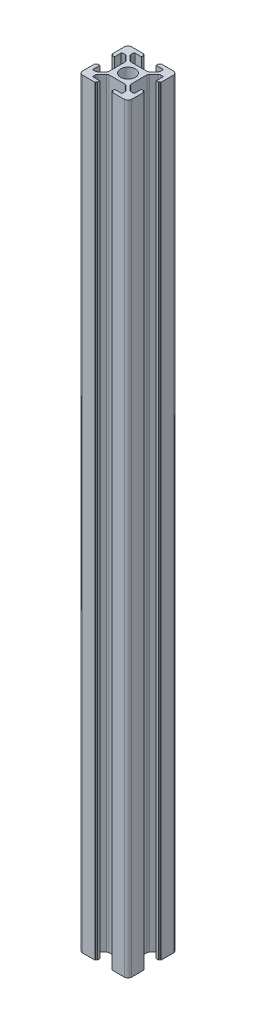
from build123d import *

# Parameters (mm, degrees)
BOSS_EXTRU_1_CORPS_DEPTH    = 310
CONG_1_R                    = 1.5
CONG_2_R                    = 0.4
CONG_4_R                    = 1
CONG_1_OF_SYM_TRIE_BRAS_R   = 1.5
CONG_2_OF_SYM_TRIE_BRAS_R   = 0.4
CONG_4_OF_SYM_TRIE_BRAS_R   = 1
SYM_TRIE_BRAS_DOUBLE_DEPTH  = 310
APR_S_TARODAGE_M6_R         = 3
ENL_V_MAT_FILETAGE_M6_DEPTH = 311.322412984


# Read off the part's stored shape, not the designer's step: Symétrie Bras double
with BuildPart() as part:
    # Esquisse4 → Boss.-Extru.1 Corps (new body)
    with BuildSketch(Plane(origin=(0, 0, 0), x_dir=(1, 0, 0), z_dir=(0, 1, 0))):
        Polygon((0, 0), (-4.5, 0), (-4.5, 3.625), (-6.875, 6), (-8.5, 6), (-8.5, 3), (-9.5, 3), (-9.5, 3.5), (-10, 3.5), (-10, 10), (-3.5, 10), (-3.5, 9.5), (-3, 9.5), (-3, 8.5), (-6, 8.5), (-6, 6.875), (-3.625, 4.5), (0, 4.5), align=None)
    boss_extru_1_corps = extrude(amount=BOSS_EXTRU_1_CORPS_DEPTH)

    # Congé1
    cong_1_edges = [part.edges().sort_by_distance(p)[0] for p in [
        (-10, 155, -10),
    ]]
    fillet(cong_1_edges, radius=CONG_1_R)

    # Congé2
    cong_2_edges = [part.edges().sort_by_distance(p)[0] for p in [
        (-8.5, 155, -6),
        (-6, 155, -8.5),
    ]]
    fillet(cong_2_edges, radius=CONG_2_R)

    # Congé4
    cong_4_edges = [part.edges().sort_by_distance(p)[0] for p in [
        (-4.5, 155, -3.625),
        (-6.875, 155, -6),
        (-6, 155, -6.875),
        (-3.625, 155, -4.5),
    ]]
    fillet(cong_4_edges, radius=CONG_4_R)

    # Symétrie Bras: Boss.-Extru.1 Corps across plane
    add(boss_extru_1_corps.mirror(Plane(origin=(0, 310, -4.5), x_dir=(0, 0, 1), z_dir=(-1, 0, 0))))

    # Congé1 of Symétrie Bras
    cong_1_of_sym_trie_bras_edges = [part.edges().sort_by_distance(p)[0] for p in [
        (10, 155, -10),
    ]]
    fillet(cong_1_of_sym_trie_bras_edges, radius=CONG_1_OF_SYM_TRIE_BRAS_R)

    # Congé2 of Symétrie Bras
    cong_2_of_sym_trie_bras_edges = [part.edges().sort_by_distance(p)[0] for p in [
        (8.5, 155, -6),
        (6, 155, -8.5),
    ]]
    fillet(cong_2_of_sym_trie_bras_edges, radius=CONG_2_OF_SYM_TRIE_BRAS_R)

    # Congé4 of Symétrie Bras
    cong_4_of_sym_trie_bras_edges = [part.edges().sort_by_distance(p)[0] for p in [
        (4.5, 155, -3.625),
        (6.875, 155, -6),
        (6, 155, -6.875),
        (3.625, 155, -4.5),
    ]]
    fillet(cong_4_of_sym_trie_bras_edges, radius=CONG_4_OF_SYM_TRIE_BRAS_R)

    # Symétrie Bras double outline → Symétrie Bras double (add)
    with BuildSketch(Plane(origin=(0, 0, 0), x_dir=(1, 0, 0), z_dir=(0, 1, 0))):
        with BuildLine():
            ThreePointArc((7.289213562, -6), (6.90653013, -5.923879533), (6.582106781, -5.707106781))
            Line((6.582106781, -5.707106781), (4.792893219, -3.917893219))
            ThreePointArc((4.792893219, -3.917893219), (4.576120467, -3.59346987), (4.5, -3.210786438))
            Line((4.5, -3.210786438), (4.5, 0))
            Line((4.5, 0), (-4.5, 0))
            Line((-4.5, 0), (-4.5, -3.210786438))
            ThreePointArc((-4.5, -3.210786438), (-4.576120467, -3.59346987), (-4.792893219, -3.917893219))
            Line((-4.792893219, -3.917893219), (-6.582106781, -5.707106781))
            ThreePointArc((-6.582106781, -5.707106781), (-6.90653013, -5.923879533), (-7.289213562, -6))
            Line((-7.289213562, -6), (-8.1, -6))
            ThreePointArc((-8.1, -6), (-8.382842712, -5.882842712), (-8.5, -5.6))
            Line((-8.5, -5.6), (-8.5, -3))
            Line((-8.5, -3), (-9.5, -3))
            Line((-9.5, -3), (-9.5, -3.5))
            Line((-9.5, -3.5), (-10, -3.5))
            Line((-10, -3.5), (-10, -8.5))
            ThreePointArc((-10, -8.5), (-9.560660172, -9.560660172), (-8.5, -10))
            Line((-8.5, -10), (-3.5, -10))
            Line((-3.5, -10), (-3.5, -9.5))
            Line((-3.5, -9.5), (-3, -9.5))
            Line((-3, -9.5), (-3, -8.5))
            Line((-3, -8.5), (-5.6, -8.5))
            ThreePointArc((-5.6, -8.5), (-5.882842712, -8.382842712), (-6, -8.1))
            Line((-6, -8.1), (-6, -7.289213562))
            ThreePointArc((-6, -7.289213562), (-5.923879533, -6.90653013), (-5.707106781, -6.582106781))
            Line((-5.707106781, -6.582106781), (-3.917893219, -4.792893219))
            ThreePointArc((-3.917893219, -4.792893219), (-3.59346987, -4.576120467), (-3.210786438, -4.5))
            Line((-3.210786438, -4.5), (3.210786438, -4.5))
            ThreePointArc((3.210786438, -4.5), (3.59346987, -4.576120467), (3.917893219, -4.792893219))
            Line((3.917893219, -4.792893219), (5.707106781, -6.582106781))
            ThreePointArc((5.707106781, -6.582106781), (5.923879533, -6.90653013), (6, -7.289213562))
            Line((6, -7.289213562), (6, -8.1))
            ThreePointArc((6, -8.1), (5.882842712, -8.382842712), (5.6, -8.5))
            Line((5.6, -8.5), (3, -8.5))
            Line((3, -8.5), (3, -9.5))
            Line((3, -9.5), (3.5, -9.5))
            Line((3.5, -9.5), (3.5, -10))
            Line((3.5, -10), (8.5, -10))
            ThreePointArc((8.5, -10), (9.560660172, -9.560660172), (10, -8.5))
            Line((10, -8.5), (10, -3.5))
            Line((10, -3.5), (9.5, -3.5))
            Line((9.5, -3.5), (9.5, -3))
            Line((9.5, -3), (8.5, -3))
            Line((8.5, -3), (8.5, -5.6))
            ThreePointArc((8.5, -5.6), (8.382842712, -5.882842712), (8.1, -6))
            Line((8.1, -6), (7.289213562, -6))
        make_face()
    extrude(amount=SYM_TRIE_BRAS_DOUBLE_DEPTH)

    # Après tarodage M6 → Enlèv. mat.-Filetage M6 (cut, through all)
    with BuildSketch(Plane.XZ):
        with Locations(Location((0, 0, 0), (0, 0, 270))):
            Circle(APR_S_TARODAGE_M6_R)
    extrude(amount=-ENL_V_MAT_FILETAGE_M6_DEPTH, mode=Mode.SUBTRACT)


solid = part.part
